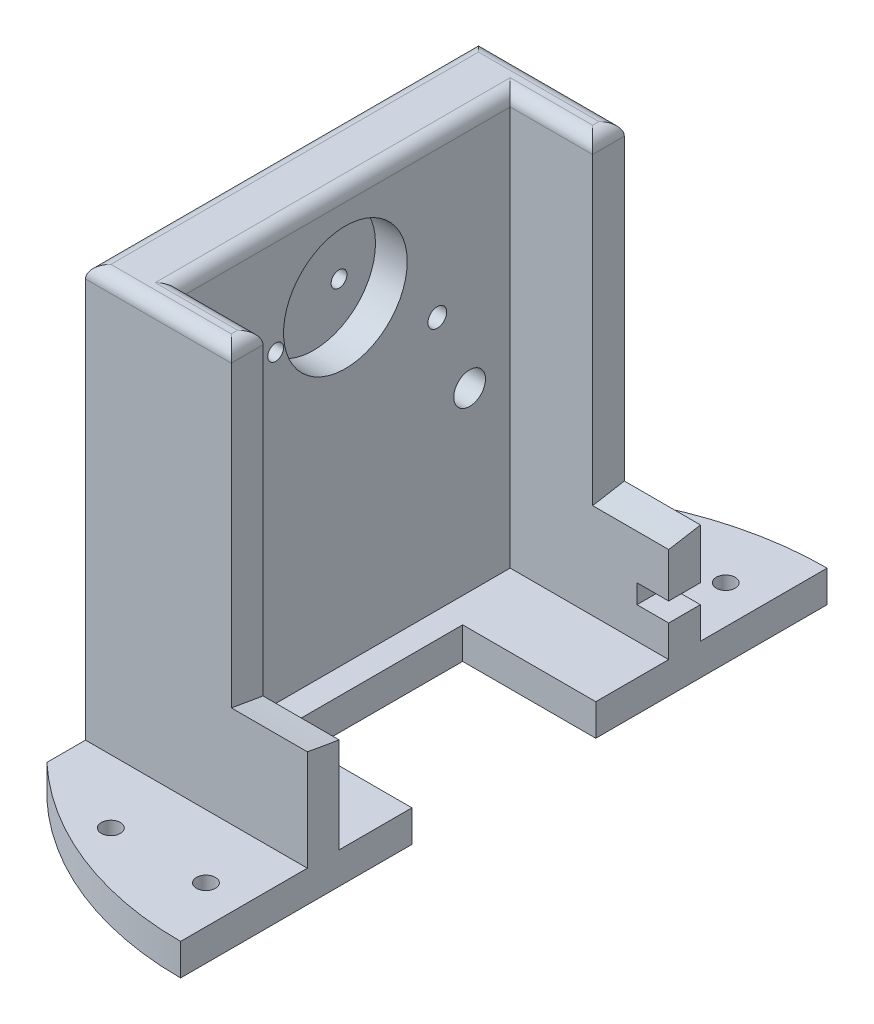
from build123d import *

# Parameters (mm, degrees)
BOSS_EXTRU_7_DEPTH          = 35
BOSS_EXTRU_8_DEPTH          = 5
ESQUISSE3_R                 = 2.5
ENL_V_MAT_EXTRU_1_DEPTH     = 5
ENL_V_MAT_EXTRU_2_DEPTH     = 12
ESQUISSE6_R                 = 9.75
ENL_V_MAT_EXTRU_3_DEPTH     = 5
CONG_1_R                    = 2
ESQUISSE8_R                 = 1.5
ENL_V_MAT_EXTRU_5_DEPTH     = 90.727364834
TROU_TARAUD_M31_D           = 2.5
TROU_TARAUD_M31_DEPTH       = 12.5
TROU_TARAUD_M31_TIP         = 0.751075774
ENL_V_START                 = -35
ENL_V_MAT_EXTRU_6_OUTLINE_R = 1.475
ENL_V_MAT_EXTRU_6_DEPTH     = 10
ENL_V_MAT_EXTRU_7_DEPTH     = 99.692704898
ENL_V_MAT_EXTRU_8_DEPTH     = 10


# Read off the part's stored shape, not the designer's step: Enlèv. mat.-Extru.6
with BuildPart() as part:
    # Esquisse1 → Boss.-Extru.7 (new, symmetric)
    with BuildSketch(Plane(origin=(0, 0, 0), x_dir=(1, 0, 0), z_dir=(0, 1, 0))):
        Polygon((-35, 31), (-35, -31), (0, -31), (0, -26), (-25, -26), (-25, -22.1), (-25, -17.1), (-25, 17.1), (-25, 22.1), (-25, 26), (0, 26), (0, 31), align=None)
    extrude(amount=BOSS_EXTRU_7_DEPTH, both=True)

    # Esquisse2 → Boss.-Extru.8 (add)
    with BuildSketch(Plane.XZ.offset(35)):
        with BuildLine():
            Line((-35, 37.094473982), (-35, -37.094473982))
            ThreePointArc((-35, -37.094473982), (-18.830584523, -47.396298237), (0, -51))
            Line((0, -51), (0, 51))
            ThreePointArc((0, 51), (-18.830584523, 47.396298237), (-35, 37.094473982))
        make_face()
    extrude(amount=-BOSS_EXTRU_8_DEPTH)

    # Esquisse3 → Enlèv. mat.-Extru.1 (cut)
    with BuildSketch(Plane(origin=(-25, 0, 0), x_dir=(0, 0, -1), z_dir=(1, 0, 0))):
        with Locations((-19.6, -2.21)):
            Circle(ESQUISSE3_R)
        with Locations((19.6, -2.21)):
            Circle(ESQUISSE3_R)
    extrude(amount=-ENL_V_MAT_EXTRU_1_DEPTH, mode=Mode.SUBTRACT)

    # Esquisse5 → Enlèv. mat.-Extru.2 (cut)
    with BuildSketch(Plane(origin=(0, 0, 0), x_dir=(0, 0, -1), z_dir=(1, 0, 0))):
        with BuildLine():
            Line((98.051206934, 14.815086571), (40.674477228, 51.032394683))
            ThreePointArc((40.674477228, 51.032394683), (34.260412481, 48.633219758), (27.706013605, 46.649253461))
            ThreePointArc((27.706013605, 46.649253461), (-0.631861598, 43.001865666), (-28.924683694, 46.983677637))
            ThreePointArc((-28.924683694, 46.983677637), (-34.858411147, 48.837303455), (-40.674477228, 51.032394683))
            Line((-40.674477228, 51.032394683), (-98.051206934, 14.815086571))
            ThreePointArc((-98.051206934, 14.815086571), (-66.125172065, -3.350779651), (-31, -14.097531974))
            Line((-31, -14.097531974), (-31, 35))
            Line((-31, 35), (-26, 35))
            Line((-26, 35), (-26, -14.963632356))
            ThreePointArc((-26, -14.963632356), (0, -17), (26, -14.963632356))
            Line((26, -14.963632356), (26, 35))
            Line((26, 35), (31, 35))
            Line((31, 35), (31, -14.097531974))
            ThreePointArc((31, -14.097531974), (66.125172065, -3.350779651), (98.051206934, 14.815086571))
        make_face()
        with BuildLine():
            ThreePointArc((-31, -14.097531974), (-28.503289853, -14.549574498), (-26, -14.963632356))
            Line((-26, -14.963632356), (-26, 35))
            Line((-26, 35), (-31, 35))
            Line((-31, 35), (-31, -14.097531974))
        make_face()
        with BuildLine():
            ThreePointArc((26, -14.963632356), (28.503289853, -14.549574498), (31, -14.097531974))
            Line((31, -14.097531974), (31, 35))
            Line((31, 35), (26, 35))
            Line((26, 35), (26, -14.963632356))
        make_face()
    extrude(amount=-ENL_V_MAT_EXTRU_2_DEPTH, mode=Mode.SUBTRACT)

    # Esquisse6 → Enlèv. mat.-Extru.3 (cut)
    with BuildSketch(Plane(origin=(-25, 0, 0), x_dir=(0, 0, -1), z_dir=(1, 0, 0))):
        with Locations((0, 20)):
            Circle(ESQUISSE6_R)
    extrude(amount=-ENL_V_MAT_EXTRU_3_DEPTH, mode=Mode.SUBTRACT)

    # Congé1
    cong_1_edges = [part.edges().sort_by_distance(p)[0] for p in [
        (-23.5, 35, 31),
        (-18.5, 35, 26),
        (-25, 35, 0),
        (-18.5, 35, -26),
        (-23.5, 35, -31),
        (-12, 35, -28.5),
        (-12, 35, 28.5),
        (-35, 35, 0),
    ]]
    fillet(cong_1_edges, radius=CONG_1_R)

    # Esquisse8 → Enlèv. mat.-Extru.5 (cut, through all)
    with BuildSketch(Plane(origin=(0, -30, 0), x_dir=(1, 0, 0), z_dir=(0, 1, 0))):
        with Locations(Location((-21, 41, 0), (0, 0, 270))):
            Circle(ESQUISSE8_R)
        with Locations(Location((-6, 41, 0), (0, 0, 270))):
            Circle(ESQUISSE8_R)
        with Locations(Location((-6, -41, 0), (0, 0, 90))):
            Circle(ESQUISSE8_R)
        with Locations(Location((-21, -41, 0), (0, 0, 90))):
            Circle(ESQUISSE8_R)
    extrude(amount=-ENL_V_MAT_EXTRU_5_DEPTH, mode=Mode.SUBTRACT)

    # Trou taraudé M31
    with Locations(Plane(origin=(-35, 18, -4), x_dir=(0, 0, -1), z_dir=(-1, 0, 0))):
        with Locations((0, 0), (-15, 0), (-30, 0)):
            Hole(TROU_TARAUD_M31_D / 2, depth=TROU_TARAUD_M31_DEPTH)
            with Locations((0, 0, -(TROU_TARAUD_M31_DEPTH + TROU_TARAUD_M31_TIP / 2))):  # 118° drill point
                Cone(0, TROU_TARAUD_M31_D / 2, TROU_TARAUD_M31_TIP, mode=Mode.SUBTRACT)

    # Enlèv. mat.-Extru.6 outline → Enlèv. mat.-Extru.6 (cut)
    with BuildSketch(Plane.YZ.offset(ENL_V_START)):
        with Locations((10, -14.5)):
            Circle(ENL_V_MAT_EXTRU_6_OUTLINE_R)
        with Locations((10, 14.5)):
            Circle(ENL_V_MAT_EXTRU_6_OUTLINE_R)
    extrude(amount=ENL_V_MAT_EXTRU_6_DEPTH, mode=Mode.SUBTRACT)

    # Esquisse3D3 → Enlèv. mat.-Extru.7 (cut, through all)
    with BuildSketch(Plane(origin=(0, -30, -14.5), x_dir=(-0.586509812151843, 0, 0.8099421215430211), z_dir=(0, -1, 0))):
        Polygon((0, 0), (12.316706055, 17.008784552), (35.80502758, 0), (23.488321525, -17.008784552), align=None)
    extrude(amount=ENL_V_MAT_EXTRU_7_DEPTH, mode=Mode.SUBTRACT)

    # Esquisse3D4 → Enlèv. mat.-Extru.8 (cut)
    with BuildSketch(Plane(origin=(0, -22, -31), x_dir=(-0.8574929257125444, -0.5144957554275261, 0), z_dir=(0, 0, -1))):
        Polygon((0, 0), (4.287464629, 2.572478777), (5.830951895, 0), (1.543487266, -2.572478777), align=None)
    extrude(amount=-ENL_V_MAT_EXTRU_8_DEPTH, mode=Mode.SUBTRACT)


solid = part.part
